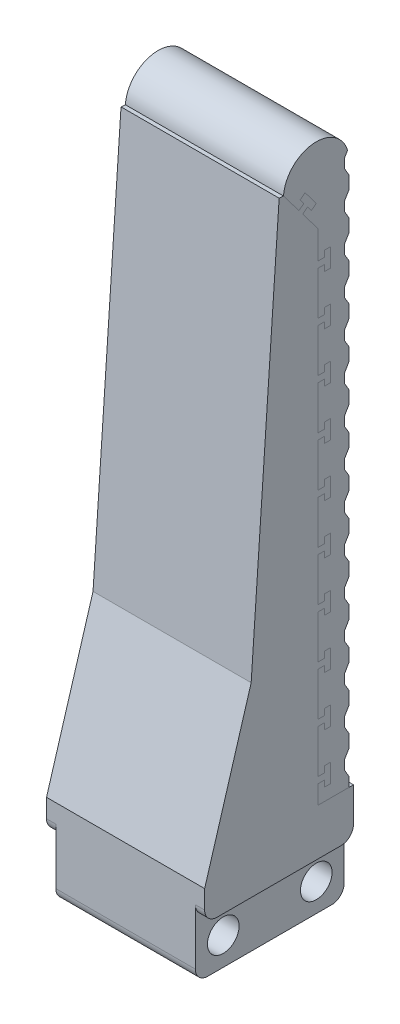
from build123d import *

# Parameters (mm, degrees)
THUMB_BASE_START     = -11.25
THUMB_BASE_OUTLINE_R = 2.55
THUMB_BASE_DEPTH     = 22.5
THUMB_BASE_START_2   = -12.75
THUMB_BASE_2_DEPTH   = 25.5
THUMB_FRAME_DEPTH    = 25.5
CAVITY_PAD_DEPTH     = 114.552851131
RIDGES_DEPTH         = 25.5
PAD_HOOKS_DEPTH      = 25.5
PAD_MATERIAL_DEPTH   = 25.5
WALL_REMOVAL_DEPTH   = 114.552851131


# Read off the part's stored shape, not the designer's step: Surface Bodies1
with BuildPart() as part:
    # thumb_base outline → thumb_base (new body)
    with BuildSketch(Plane.YZ.offset(THUMB_BASE_START)):
        with BuildLine():
            Line((2, -12), (14, -12))
            Line((14, -12), (14, 12))
            Line((14, 12), (2, 12))
            ThreePointArc((2, 12), (0.585786438, 11.414213562), (0, 10))
            Line((0, 10), (0, -10))
            ThreePointArc((0, -10), (0.585786438, -11.414213562), (2, -12))
        make_face()
        with Locations((4.5, -7.5)):
            Circle(THUMB_BASE_OUTLINE_R, mode=Mode.SUBTRACT)
        with Locations((4.5, 7.5)):
            Circle(THUMB_BASE_OUTLINE_R, mode=Mode.SUBTRACT)
    extrude(amount=THUMB_BASE_DEPTH)

    # thumb_base 2 outline → thumb_base 2 (add)
    with BuildSketch(Plane.YZ.offset(THUMB_BASE_START_2)):
        with BuildLine():
            Line((9, 10), (9, -10))
            ThreePointArc((9, -10), (9.585786438, -11.414213562), (11, -12))
            Line((11, -12), (14, -12))
            Line((14, -12), (14, 12))
            Line((14, 12), (11, 12))
            ThreePointArc((11, 12), (9.585786438, 11.414213562), (9, 10))
        make_face()
    extrude(amount=THUMB_BASE_2_DEPTH)

    # Sketch3 → Thumb Frame (add)
    with BuildSketch(Plane(origin=(12.75, 0, 0), x_dir=(0, 0, -1), z_dir=(1, 0, 0))):
        with BuildLine():
            Line((12, 14), (12, 104))
            ThreePointArc((12, 104), (6.206665041, 109.99643974), (0.014236813, 104.413084822))
            Line((0.014236813, 104.413084822), (-4.5, 39))
            Line((-4.5, 39), (-12, 14))
            Line((-12, 14), (12, 14))
        make_face()
    extrude(amount=-THUMB_FRAME_DEPTH)

    # Sketch4 → Cavity - Pad (cut, through all)
    with BuildSketch(Plane(origin=(12.75, 0, 0), x_dir=(0, 0, -1), z_dir=(1, 0, 0))):
        with BuildLine():
            Line((0.712575852, 104.364891593), (6.3, 97))
            Line((6.3, 97), (6.3, 16.5))
            Line((6.3, 16.5), (11.3, 16.5))
            Line((11.3, 16.5), (11.3, 104))
            ThreePointArc((11.3, 104), (6.18255412, 109.296855104), (0.712575852, 104.364891593))
        make_face()
    extrude(amount=-CAVITY_PAD_DEPTH, mode=Mode.SUBTRACT)

    # Sketch5 → Ridges (add)
    with BuildSketch(Plane(origin=(12.75, 0, 0), x_dir=(0, 0, -1), z_dir=(1, 0, 0))):
        Polygon((11.3, 18), (10.55, 19.264783013), (10.55, 20.735216987), (11.3, 22), align=None)
        Polygon((10.55, 26.735216987), (11.3, 28), (11.3, 24), (10.55, 25.264783013), align=None)
        Polygon((10.55, 32.735216987), (11.3, 34), (11.3, 30), (10.55, 31.264783013), align=None)
        Polygon((10.55, 38.735216987), (11.3, 40), (11.3, 36), (10.55, 37.264783013), align=None)
        Polygon((10.55, 44.735216987), (11.3, 46), (11.3, 42), (10.55, 43.264783013), align=None)
        Polygon((10.55, 50.735216987), (11.3, 52), (11.3, 48), (10.55, 49.264783013), align=None)
        Polygon((10.55, 56.735216987), (11.3, 58), (11.3, 54), (10.55, 55.264783013), align=None)
        Polygon((10.55, 62.735216987), (11.3, 64), (11.3, 60), (10.55, 61.264783013), align=None)
        Polygon((10.55, 68.735216987), (11.3, 70), (11.3, 66), (10.55, 67.264783013), align=None)
        Polygon((10.55, 74.735216987), (11.3, 76), (11.3, 72), (10.55, 73.264783013), align=None)
        Polygon((10.55, 80.735216987), (11.3, 82), (11.3, 78), (10.55, 79.264783013), align=None)
        Polygon((10.55, 86.735216987), (11.3, 88), (11.3, 84), (10.55, 85.264783013), align=None)
        Polygon((10.55, 92.735216987), (11.3, 94), (11.3, 90), (10.55, 91.264783013), align=None)
        Polygon((10.55, 98.735216987), (11.3, 100), (11.3, 96), (10.55, 97.264783013), align=None)
        Polygon((10.55, 104.735216987), (11.3, 106), (11.3, 102), (10.55, 103.264783013), align=None)
    extrude(amount=-RIDGES_DEPTH)

    # Sketch6 → Pad Hooks (add)
    with BuildSketch(Plane(origin=(12.75, 0, 0), x_dir=(0, 0, -1), z_dir=(1, 0, 0))):
        Polygon((6.3, 19.5), (7.3, 19.5), (7.3, 18.5), (8.3, 18.5), (8.3, 21.5), (7.3, 21.5), (7.3, 20.5), (6.3, 20.5), align=None)
        Polygon((6.3, 28.5), (6.3, 27.5), (7.3, 27.5), (7.3, 26.5), (8.3, 26.5), (8.3, 29.5), (7.3, 29.5), (7.3, 28.5), align=None)
        Polygon((6.3, 36.5), (6.3, 35.5), (7.3, 35.5), (7.3, 34.5), (8.3, 34.5), (8.3, 37.5), (7.3, 37.5), (7.3, 36.5), align=None)
        Polygon((6.3, 44.5), (6.3, 43.5), (7.3, 43.5), (7.3, 42.5), (8.3, 42.5), (8.3, 45.5), (7.3, 45.5), (7.3, 44.5), align=None)
        Polygon((6.3, 52.5), (6.3, 51.5), (7.3, 51.5), (7.3, 50.5), (8.3, 50.5), (8.3, 53.5), (7.3, 53.5), (7.3, 52.5), align=None)
        Polygon((6.3, 60.5), (6.3, 59.5), (7.3, 59.5), (7.3, 58.5), (8.3, 58.5), (8.3, 61.5), (7.3, 61.5), (7.3, 60.5), align=None)
        Polygon((6.3, 68.5), (6.3, 67.5), (7.3, 67.5), (7.3, 66.5), (8.3, 66.5), (8.3, 69.5), (7.3, 69.5), (7.3, 68.5), align=None)
        Polygon((6.3, 76.5), (6.3, 75.5), (7.3, 75.5), (7.3, 74.5), (8.3, 74.5), (8.3, 77.5), (7.3, 77.5), (7.3, 76.5), align=None)
        Polygon((6.3, 84.5), (6.3, 83.5), (7.3, 83.5), (7.3, 82.5), (8.3, 82.5), (8.3, 85.5), (7.3, 85.5), (7.3, 84.5), align=None)
        Polygon((6.3, 92.5), (6.3, 91.5), (7.3, 91.5), (7.3, 90.5), (8.3, 90.5), (8.3, 93.5), (7.3, 93.5), (7.3, 92.5), align=None)
        Polygon((3.808490264, 100.284107063), (3.204085588, 101.08078453), (4.000763055, 101.685189207), (3.396358379, 102.481866674), (4.193035846, 103.086271351), (6.006249875, 100.696238948), (5.209572408, 100.091834272), (4.605167731, 100.888511739), align=None)
    extrude(amount=-PAD_HOOKS_DEPTH)

    # Sketch8 → Wall Removal (cut, through all)
    with BuildSketch(Plane(origin=(12.75, 0, 0), x_dir=(0, 0, -1), z_dir=(1, 0, 0))):
        with BuildLine():
            Line((11.3, 18), (11.3, 16.5))
            Line((11.3, 16.5), (12, 16.5))
            Line((12, 16.5), (12, 104))
            ThreePointArc((12, 104), (6.206665041, 109.99643974), (0.014236813, 104.413084822))
            Line((0.014236813, 104.413084822), (0.712575852, 104.364891593))
            ThreePointArc((0.712575852, 104.364891593), (5.377173399, 109.263277213), (11.056223375, 105.588900621))
            Line((11.056223375, 105.588900621), (10.55, 104.735216987))
            Line((10.55, 104.735216987), (10.55, 103.264783013))
            Line((10.55, 103.264783013), (11.3, 102))
            Line((11.3, 102), (11.3, 100))
            Line((11.3, 100), (10.55, 98.735216987))
            Line((10.55, 98.735216987), (10.55, 97.264783013))
            Line((10.55, 97.264783013), (11.3, 96))
            Line((11.3, 96), (11.3, 94))
            Line((11.3, 94), (10.55, 92.735216987))
            Line((10.55, 92.735216987), (10.55, 91.264783013))
            Line((10.55, 91.264783013), (11.3, 90))
            Line((11.3, 90), (11.3, 88))
            Line((11.3, 88), (10.55, 86.735216987))
            Line((10.55, 86.735216987), (10.55, 85.264783013))
            Line((10.55, 85.264783013), (11.3, 84))
            Line((11.3, 84), (11.3, 82))
            Line((11.3, 82), (10.55, 80.735216987))
            Line((10.55, 80.735216987), (10.55, 79.264783013))
            Line((10.55, 79.264783013), (11.3, 78))
            Line((11.3, 78), (11.3, 76))
            Line((11.3, 76), (10.55, 74.735216987))
            Line((10.55, 74.735216987), (10.55, 73.264783013))
            Line((10.55, 73.264783013), (11.3, 72))
            Line((11.3, 72), (11.3, 70))
            Line((11.3, 70), (10.55, 68.735216987))
            Line((10.55, 68.735216987), (10.55, 67.264783013))
            Line((10.55, 67.264783013), (11.3, 66))
            Line((11.3, 66), (11.3, 64))
            Line((11.3, 64), (10.55, 62.735216987))
            Line((10.55, 62.735216987), (10.55, 61.264783013))
            Line((10.55, 61.264783013), (11.3, 60))
            Line((11.3, 60), (11.3, 58))
            Line((11.3, 58), (10.55, 56.735216987))
            Line((10.55, 56.735216987), (10.55, 55.264783013))
            Line((10.55, 55.264783013), (11.3, 54))
            Line((11.3, 54), (11.3, 52))
            Line((11.3, 52), (10.55, 50.735216987))
            Line((10.55, 50.735216987), (10.55, 49.264783013))
            Line((10.55, 49.264783013), (11.3, 48))
            Line((11.3, 48), (11.3, 46))
            Line((11.3, 46), (10.55, 44.735216987))
            Line((10.55, 44.735216987), (10.55, 43.264783013))
            Line((10.55, 43.264783013), (11.3, 42))
            Line((11.3, 42), (11.3, 40))
            Line((11.3, 40), (10.55, 38.735216987))
            Line((10.55, 38.735216987), (10.55, 37.264783013))
            Line((10.55, 37.264783013), (11.3, 36))
            Line((11.3, 36), (11.3, 34))
            Line((11.3, 34), (10.55, 32.735216987))
            Line((10.55, 32.735216987), (10.55, 31.264783013))
            Line((10.55, 31.264783013), (11.3, 30))
            Line((11.3, 30), (11.3, 28))
            Line((11.3, 28), (10.55, 26.735216987))
            Line((10.55, 26.735216987), (10.55, 25.264783013))
            Line((10.55, 25.264783013), (11.3, 24))
            Line((11.3, 24), (11.3, 22))
            Line((11.3, 22), (10.55, 20.735216987))
            Line((10.55, 20.735216987), (10.55, 19.264783013))
            Line((10.55, 19.264783013), (11.3, 18))
        make_face()
        with BuildLine():
            Line((6.3, 16.5), (11.3, 16.5))
            Line((11.3, 16.5), (11.3, 18))
            Line((11.3, 18), (10.55, 19.264783013))
            Line((10.55, 19.264783013), (10.55, 20.735216987))
            Line((10.55, 20.735216987), (11.3, 22))
            Line((11.3, 22), (11.3, 24))
            Line((11.3, 24), (10.55, 25.264783013))
            Line((10.55, 25.264783013), (10.55, 26.735216987))
            Line((10.55, 26.735216987), (11.3, 28))
            Line((11.3, 28), (11.3, 30))
            Line((11.3, 30), (10.55, 31.264783013))
            Line((10.55, 31.264783013), (10.55, 32.735216987))
            Line((10.55, 32.735216987), (11.3, 34))
            Line((11.3, 34), (11.3, 36))
            Line((11.3, 36), (10.55, 37.264783013))
            Line((10.55, 37.264783013), (10.55, 38.735216987))
            Line((10.55, 38.735216987), (11.3, 40))
            Line((11.3, 40), (11.3, 42))
            Line((11.3, 42), (10.55, 43.264783013))
            Line((10.55, 43.264783013), (10.55, 44.735216987))
            Line((10.55, 44.735216987), (11.3, 46))
            Line((11.3, 46), (11.3, 48))
            Line((11.3, 48), (10.55, 49.264783013))
            Line((10.55, 49.264783013), (10.55, 50.735216987))
            Line((10.55, 50.735216987), (11.3, 52))
            Line((11.3, 52), (11.3, 54))
            Line((11.3, 54), (10.55, 55.264783013))
            Line((10.55, 55.264783013), (10.55, 56.735216987))
            Line((10.55, 56.735216987), (11.3, 58))
            Line((11.3, 58), (11.3, 60))
            Line((11.3, 60), (10.55, 61.264783013))
            Line((10.55, 61.264783013), (10.55, 62.735216987))
            Line((10.55, 62.735216987), (11.3, 64))
            Line((11.3, 64), (11.3, 66))
            Line((11.3, 66), (10.55, 67.264783013))
            Line((10.55, 67.264783013), (10.55, 68.735216987))
            Line((10.55, 68.735216987), (11.3, 70))
            Line((11.3, 70), (11.3, 72))
            Line((11.3, 72), (10.55, 73.264783013))
            Line((10.55, 73.264783013), (10.55, 74.735216987))
            Line((10.55, 74.735216987), (11.3, 76))
            Line((11.3, 76), (11.3, 78))
            Line((11.3, 78), (10.55, 79.264783013))
            Line((10.55, 79.264783013), (10.55, 80.735216987))
            Line((10.55, 80.735216987), (11.3, 82))
            Line((11.3, 82), (11.3, 84))
            Line((11.3, 84), (10.55, 85.264783013))
            Line((10.55, 85.264783013), (10.55, 86.735216987))
            Line((10.55, 86.735216987), (11.3, 88))
            Line((11.3, 88), (11.3, 90))
            Line((11.3, 90), (10.55, 91.264783013))
            Line((10.55, 91.264783013), (10.55, 92.735216987))
            Line((10.55, 92.735216987), (11.3, 94))
            Line((11.3, 94), (11.3, 96))
            Line((11.3, 96), (10.55, 97.264783013))
            Line((10.55, 97.264783013), (10.55, 98.735216987))
            Line((10.55, 98.735216987), (11.3, 100))
            Line((11.3, 100), (11.3, 102))
            Line((11.3, 102), (10.55, 103.264783013))
            Line((10.55, 103.264783013), (10.55, 104.735216987))
            Line((10.55, 104.735216987), (11.056223375, 105.588900621))
            ThreePointArc((11.056223375, 105.588900621), (5.377173399, 109.263277213), (0.712575852, 104.364891593))
            Line((0.712575852, 104.364891593), (3.204085588, 101.08078453))
            Line((3.204085588, 101.08078453), (4.000763055, 101.685189207))
            Line((4.000763055, 101.685189207), (3.396358379, 102.481866674))
            Line((3.396358379, 102.481866674), (4.193035846, 103.086271351))
            Line((4.193035846, 103.086271351), (6.006249875, 100.696238948))
            Line((6.006249875, 100.696238948), (5.209572408, 100.091834272))
            Line((5.209572408, 100.091834272), (4.605167731, 100.888511739))
            Line((4.605167731, 100.888511739), (3.808490264, 100.284107063))
            Line((3.808490264, 100.284107063), (6.3, 97))
            Line((6.3, 97), (6.3, 92.5))
            Line((6.3, 92.5), (7.3, 92.5))
            Line((7.3, 92.5), (7.3, 93.5))
            Line((7.3, 93.5), (8.3, 93.5))
            Line((8.3, 93.5), (8.3, 90.5))
            Line((8.3, 90.5), (7.3, 90.5))
            Line((7.3, 90.5), (7.3, 91.5))
            Line((7.3, 91.5), (6.3, 91.5))
            Line((6.3, 91.5), (6.3, 84.5))
            Line((6.3, 84.5), (7.3, 84.5))
            Line((7.3, 84.5), (7.3, 85.5))
            Line((7.3, 85.5), (8.3, 85.5))
            Line((8.3, 85.5), (8.3, 82.5))
            Line((8.3, 82.5), (7.3, 82.5))
            Line((7.3, 82.5), (7.3, 83.5))
            Line((7.3, 83.5), (6.3, 83.5))
            Line((6.3, 83.5), (6.3, 76.5))
            Line((6.3, 76.5), (7.3, 76.5))
            Line((7.3, 76.5), (7.3, 77.5))
            Line((7.3, 77.5), (8.3, 77.5))
            Line((8.3, 77.5), (8.3, 74.5))
            Line((8.3, 74.5), (7.3, 74.5))
            Line((7.3, 74.5), (7.3, 75.5))
            Line((7.3, 75.5), (6.3, 75.5))
            Line((6.3, 75.5), (6.3, 68.5))
            Line((6.3, 68.5), (7.3, 68.5))
            Line((7.3, 68.5), (7.3, 69.5))
            Line((7.3, 69.5), (8.3, 69.5))
            Line((8.3, 69.5), (8.3, 66.5))
            Line((8.3, 66.5), (7.3, 66.5))
            Line((7.3, 66.5), (7.3, 67.5))
            Line((7.3, 67.5), (6.3, 67.5))
            Line((6.3, 67.5), (6.3, 60.5))
            Line((6.3, 60.5), (7.3, 60.5))
            Line((7.3, 60.5), (7.3, 61.5))
            Line((7.3, 61.5), (8.3, 61.5))
            Line((8.3, 61.5), (8.3, 58.5))
            Line((8.3, 58.5), (7.3, 58.5))
            Line((7.3, 58.5), (7.3, 59.5))
            Line((7.3, 59.5), (6.3, 59.5))
            Line((6.3, 59.5), (6.3, 52.5))
            Line((6.3, 52.5), (7.3, 52.5))
            Line((7.3, 52.5), (7.3, 53.5))
            Line((7.3, 53.5), (8.3, 53.5))
            Line((8.3, 53.5), (8.3, 50.5))
            Line((8.3, 50.5), (7.3, 50.5))
            Line((7.3, 50.5), (7.3, 51.5))
            Line((7.3, 51.5), (6.3, 51.5))
            Line((6.3, 51.5), (6.3, 44.5))
            Line((6.3, 44.5), (7.3, 44.5))
            Line((7.3, 44.5), (7.3, 45.5))
            Line((7.3, 45.5), (8.3, 45.5))
            Line((8.3, 45.5), (8.3, 42.5))
            Line((8.3, 42.5), (7.3, 42.5))
            Line((7.3, 42.5), (7.3, 43.5))
            Line((7.3, 43.5), (6.3, 43.5))
            Line((6.3, 43.5), (6.3, 36.5))
            Line((6.3, 36.5), (7.3, 36.5))
            Line((7.3, 36.5), (7.3, 37.5))
            Line((7.3, 37.5), (8.3, 37.5))
            Line((8.3, 37.5), (8.3, 34.5))
            Line((8.3, 34.5), (7.3, 34.5))
            Line((7.3, 34.5), (7.3, 35.5))
            Line((7.3, 35.5), (6.3, 35.5))
            Line((6.3, 35.5), (6.3, 28.5))
            Line((6.3, 28.5), (7.3, 28.5))
            Line((7.3, 28.5), (7.3, 29.5))
            Line((7.3, 29.5), (8.3, 29.5))
            Line((8.3, 29.5), (8.3, 26.5))
            Line((8.3, 26.5), (7.3, 26.5))
            Line((7.3, 26.5), (7.3, 27.5))
            Line((7.3, 27.5), (6.3, 27.5))
            Line((6.3, 27.5), (6.3, 20.5))
            Line((6.3, 20.5), (7.3, 20.5))
            Line((7.3, 20.5), (7.3, 21.5))
            Line((7.3, 21.5), (8.3, 21.5))
            Line((8.3, 21.5), (8.3, 18.5))
            Line((8.3, 18.5), (7.3, 18.5))
            Line((7.3, 18.5), (7.3, 19.5))
            Line((7.3, 19.5), (6.3, 19.5))
            Line((6.3, 19.5), (6.3, 16.5))
        make_face()
    extrude(amount=-WALL_REMOVAL_DEPTH, mode=Mode.SUBTRACT)


with BuildPart() as body_2:
    # Sketch7 → Pad Material (new body)
    with BuildSketch(Plane(origin=(12.75, 0, 0), x_dir=(0, 0, -1), z_dir=(1, 0, 0))):
        with BuildLine():
            Line((7.3, 19.5), (6.3, 19.5))
            Line((6.3, 19.5), (6.3, 16.5))
            Line((6.3, 16.5), (11.3, 16.5))
            Line((11.3, 16.5), (11.3, 18))
            Line((11.3, 18), (10.55, 19.264783013))
            Line((10.55, 19.264783013), (10.55, 20.735216987))
            Line((10.55, 20.735216987), (11.3, 22))
            Line((11.3, 22), (11.3, 24))
            Line((11.3, 24), (10.55, 25.264783013))
            Line((10.55, 25.264783013), (10.55, 26.735216987))
            Line((10.55, 26.735216987), (11.3, 28))
            Line((11.3, 28), (11.3, 30))
            Line((11.3, 30), (10.55, 31.264783013))
            Line((10.55, 31.264783013), (10.55, 32.735216987))
            Line((10.55, 32.735216987), (11.3, 34))
            Line((11.3, 34), (11.3, 36))
            Line((11.3, 36), (10.55, 37.264783013))
            Line((10.55, 37.264783013), (10.55, 38.735216987))
            Line((10.55, 38.735216987), (11.3, 40))
            Line((11.3, 40), (11.3, 42))
            Line((11.3, 42), (10.55, 43.264783013))
            Line((10.55, 43.264783013), (10.55, 44.735216987))
            Line((10.55, 44.735216987), (11.3, 46))
            Line((11.3, 46), (11.3, 48))
            Line((11.3, 48), (10.55, 49.264783013))
            Line((10.55, 49.264783013), (10.55, 50.735216987))
            Line((10.55, 50.735216987), (11.3, 52))
            Line((11.3, 52), (11.3, 54))
            Line((11.3, 54), (10.55, 55.264783013))
            Line((10.55, 55.264783013), (10.55, 56.735216987))
            Line((10.55, 56.735216987), (11.3, 58))
            Line((11.3, 58), (11.3, 60))
            Line((11.3, 60), (10.55, 61.264783013))
            Line((10.55, 61.264783013), (10.55, 62.735216987))
            Line((10.55, 62.735216987), (11.3, 64))
            Line((11.3, 64), (11.3, 66))
            Line((11.3, 66), (10.55, 67.264783013))
            Line((10.55, 67.264783013), (10.55, 68.735216987))
            Line((10.55, 68.735216987), (11.3, 70))
            Line((11.3, 70), (11.3, 72))
            Line((11.3, 72), (10.55, 73.264783013))
            Line((10.55, 73.264783013), (10.55, 74.735216987))
            Line((10.55, 74.735216987), (11.3, 76))
            Line((11.3, 76), (11.3, 78))
            Line((11.3, 78), (10.55, 79.264783013))
            Line((10.55, 79.264783013), (10.55, 80.735216987))
            Line((10.55, 80.735216987), (11.3, 82))
            Line((11.3, 82), (11.3, 84))
            Line((11.3, 84), (10.55, 85.264783013))
            Line((10.55, 85.264783013), (10.55, 86.735216987))
            Line((10.55, 86.735216987), (11.3, 88))
            Line((11.3, 88), (11.3, 90))
            Line((11.3, 90), (10.55, 91.264783013))
            Line((10.55, 91.264783013), (10.55, 92.735216987))
            Line((10.55, 92.735216987), (11.3, 94))
            Line((11.3, 94), (11.3, 96))
            Line((11.3, 96), (10.55, 97.264783013))
            Line((10.55, 97.264783013), (10.55, 98.735216987))
            Line((10.55, 98.735216987), (11.3, 100))
            Line((11.3, 100), (11.3, 102))
            Line((11.3, 102), (10.55, 103.264783013))
            Line((10.55, 103.264783013), (10.55, 104.735216987))
            Line((10.55, 104.735216987), (11.056223375, 105.588900621))
            ThreePointArc((11.056223375, 105.588900621), (5.377173399, 109.263277213), (0.712575852, 104.364891593))
            Line((0.712575852, 104.364891593), (3.204085588, 101.08078453))
            Line((3.204085588, 101.08078453), (4.000763055, 101.685189207))
            Line((4.000763055, 101.685189207), (3.396358379, 102.481866674))
            Line((3.396358379, 102.481866674), (4.193035846, 103.086271351))
            Line((4.193035846, 103.086271351), (6.006249875, 100.696238948))
            Line((6.006249875, 100.696238948), (5.209572408, 100.091834272))
            Line((5.209572408, 100.091834272), (4.605167731, 100.888511739))
            Line((4.605167731, 100.888511739), (3.808490264, 100.284107063))
            Line((3.808490264, 100.284107063), (6.3, 97))
            Line((6.3, 97), (6.3, 92.5))
            Line((6.3, 92.5), (7.3, 92.5))
            Line((7.3, 92.5), (7.3, 93.5))
            Line((7.3, 93.5), (8.3, 93.5))
            Line((8.3, 93.5), (8.3, 90.5))
            Line((8.3, 90.5), (7.3, 90.5))
            Line((7.3, 90.5), (7.3, 91.5))
            Line((7.3, 91.5), (6.3, 91.5))
            Line((6.3, 91.5), (6.3, 84.5))
            Line((6.3, 84.5), (7.3, 84.5))
            Line((7.3, 84.5), (7.3, 85.5))
            Line((7.3, 85.5), (8.3, 85.5))
            Line((8.3, 85.5), (8.3, 82.5))
            Line((8.3, 82.5), (7.3, 82.5))
            Line((7.3, 82.5), (7.3, 83.5))
            Line((7.3, 83.5), (6.3, 83.5))
            Line((6.3, 83.5), (6.3, 76.5))
            Line((6.3, 76.5), (7.3, 76.5))
            Line((7.3, 76.5), (7.3, 77.5))
            Line((7.3, 77.5), (8.3, 77.5))
            Line((8.3, 77.5), (8.3, 74.5))
            Line((8.3, 74.5), (7.3, 74.5))
            Line((7.3, 74.5), (7.3, 75.5))
            Line((7.3, 75.5), (6.3, 75.5))
            Line((6.3, 75.5), (6.3, 68.5))
            Line((6.3, 68.5), (7.3, 68.5))
            Line((7.3, 68.5), (7.3, 69.5))
            Line((7.3, 69.5), (8.3, 69.5))
            Line((8.3, 69.5), (8.3, 66.5))
            Line((8.3, 66.5), (7.3, 66.5))
            Line((7.3, 66.5), (7.3, 67.5))
            Line((7.3, 67.5), (6.3, 67.5))
            Line((6.3, 67.5), (6.3, 60.5))
            Line((6.3, 60.5), (7.3, 60.5))
            Line((7.3, 60.5), (7.3, 61.5))
            Line((7.3, 61.5), (8.3, 61.5))
            Line((8.3, 61.5), (8.3, 58.5))
            Line((8.3, 58.5), (7.3, 58.5))
            Line((7.3, 58.5), (7.3, 59.5))
            Line((7.3, 59.5), (6.3, 59.5))
            Line((6.3, 59.5), (6.3, 52.5))
            Line((6.3, 52.5), (7.3, 52.5))
            Line((7.3, 52.5), (7.3, 53.5))
            Line((7.3, 53.5), (8.3, 53.5))
            Line((8.3, 53.5), (8.3, 50.5))
            Line((8.3, 50.5), (7.3, 50.5))
            Line((7.3, 50.5), (7.3, 51.5))
            Line((7.3, 51.5), (6.3, 51.5))
            Line((6.3, 51.5), (6.3, 44.5))
            Line((6.3, 44.5), (7.3, 44.5))
            Line((7.3, 44.5), (7.3, 45.5))
            Line((7.3, 45.5), (8.3, 45.5))
            Line((8.3, 45.5), (8.3, 42.5))
            Line((8.3, 42.5), (7.3, 42.5))
            Line((7.3, 42.5), (7.3, 43.5))
            Line((7.3, 43.5), (6.3, 43.5))
            Line((6.3, 43.5), (6.3, 36.5))
            Line((6.3, 36.5), (7.3, 36.5))
            Line((7.3, 36.5), (7.3, 37.5))
            Line((7.3, 37.5), (8.3, 37.5))
            Line((8.3, 37.5), (8.3, 34.5))
            Line((8.3, 34.5), (7.3, 34.5))
            Line((7.3, 34.5), (7.3, 35.5))
            Line((7.3, 35.5), (6.3, 35.5))
            Line((6.3, 35.5), (6.3, 28.5))
            Line((6.3, 28.5), (7.3, 28.5))
            Line((7.3, 28.5), (7.3, 29.5))
            Line((7.3, 29.5), (8.3, 29.5))
            Line((8.3, 29.5), (8.3, 26.5))
            Line((8.3, 26.5), (7.3, 26.5))
            Line((7.3, 26.5), (7.3, 27.5))
            Line((7.3, 27.5), (6.3, 27.5))
            Line((6.3, 27.5), (6.3, 20.5))
            Line((6.3, 20.5), (7.3, 20.5))
            Line((7.3, 20.5), (7.3, 21.5))
            Line((7.3, 21.5), (8.3, 21.5))
            Line((8.3, 21.5), (8.3, 18.5))
            Line((8.3, 18.5), (7.3, 18.5))
            Line((7.3, 18.5), (7.3, 19.5))
        make_face()
    extrude(amount=-PAD_MATERIAL_DEPTH)


solid = Compound([part.part, body_2.part])
